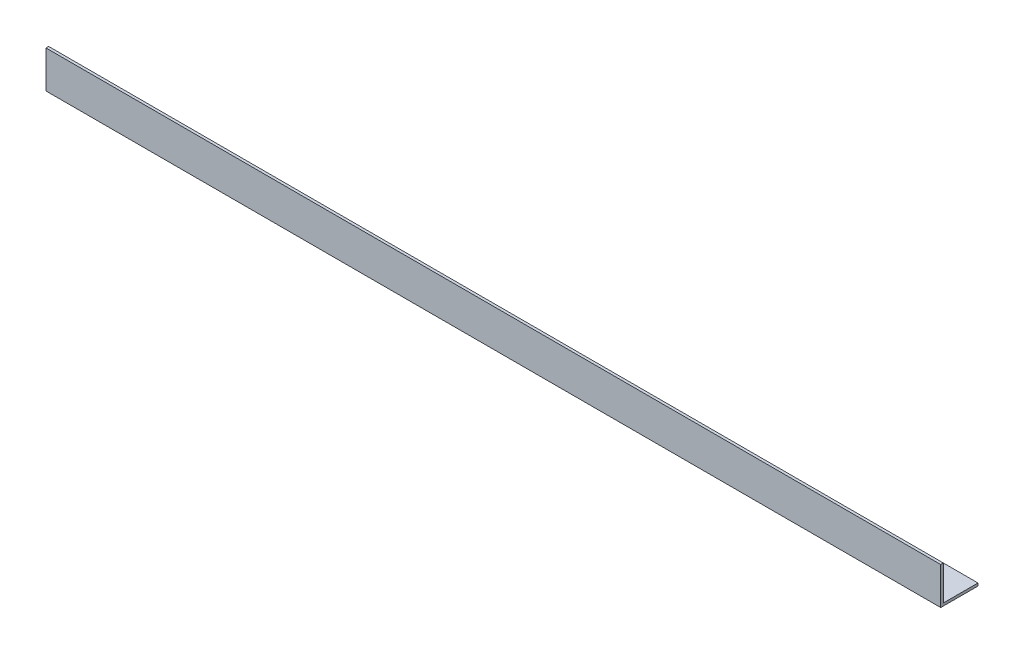
from build123d import *

# Parameters (mm, degrees)
BOSS_EXTRUDE1_DEPTH = 1066.8
SKETCH2_R           = 2.45745
CUT_EXTRUDE1_DEPTH  = 889


with BuildPart() as part:
    # Sketch1 → Boss-Extrude1 (new body)
    with BuildSketch(Plane(origin=(0, 0, 0), x_dir=(0, 0, -1), z_dir=(1, 0, 0))):
        Polygon((0, 0), (0, 44.45), (3.175, 44.45), (3.175, 3.175), (44.45, 3.175), (44.45, 0), align=None)
    extrude(amount=BOSS_EXTRUDE1_DEPTH)

    # Sketch2 → Cut-Extrude1 (cut)
    with BuildSketch(Plane(origin=(0, 3.175, 0), x_dir=(1, 0, 0), z_dir=(0, 1, 0))):
        with Locations((120.65, 22.225)):
            Circle(SKETCH2_R)
        with Locations((395.81582, 22.225)):
            Circle(SKETCH2_R)
        with Locations((670.98418, 22.225)):
            Circle(SKETCH2_R)
        with Locations((946.15, 22.225)):
            Circle(SKETCH2_R)
    extrude(amount=-CUT_EXTRUDE1_DEPTH, mode=Mode.SUBTRACT)


solid = part.part
